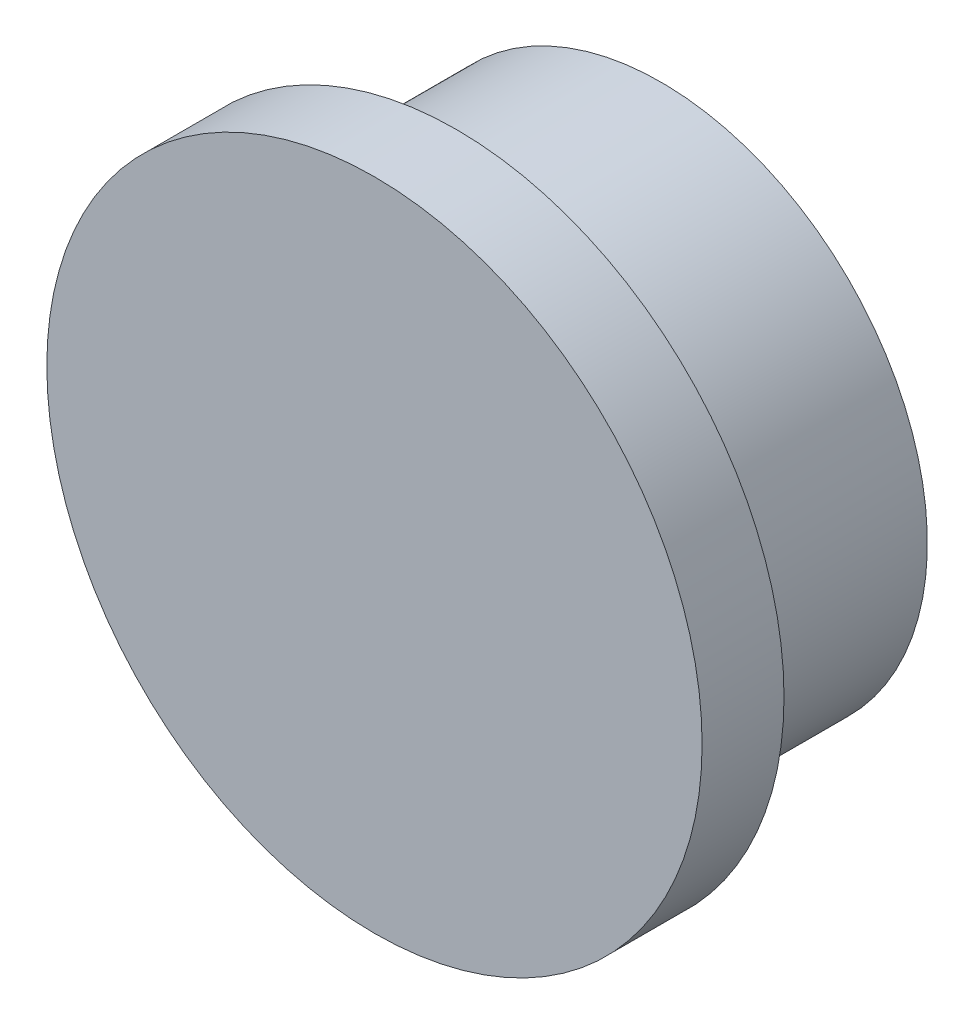
from build123d import *

# Parameters (mm, degrees)
SKETCH1_R           = 12
BOSS_EXTRUDE1_DEPTH = 3
SKETCH2_R           = 9.75
BOSS_EXTRUDE2_DEPTH = 7.5
SKETCH3_R           = 1.5
CUT_EXTRUDE1_DEPTH  = 5


with BuildPart() as part:
    # Sketch1 → Boss-Extrude1 (new body)
    with BuildSketch(Plane.XY):
        with Locations((-127.992538975, 40.103259291)):
            Circle(SKETCH1_R)
    extrude(amount=BOSS_EXTRUDE1_DEPTH)

    # Sketch2 → Boss-Extrude2 (add)
    with BuildSketch(Plane(origin=(0, 0, 0), x_dir=(-1, 0, 0), z_dir=(0, 0, -1))):
        with Locations((127.992538975, 40.103259291)):
            Circle(SKETCH2_R)
    extrude(amount=BOSS_EXTRUDE2_DEPTH)

    # Sketch3 → Cut-Extrude1 (cut)
    with BuildSketch(Plane(origin=(0, 0, -7.5), x_dir=(-1, 0, 0), z_dir=(0, 0, -1))):
        with Locations((127.992538975, 40.103259291)):
            Circle(SKETCH3_R)
    extrude(amount=-CUT_EXTRUDE1_DEPTH, mode=Mode.SUBTRACT)


solid = part.part
